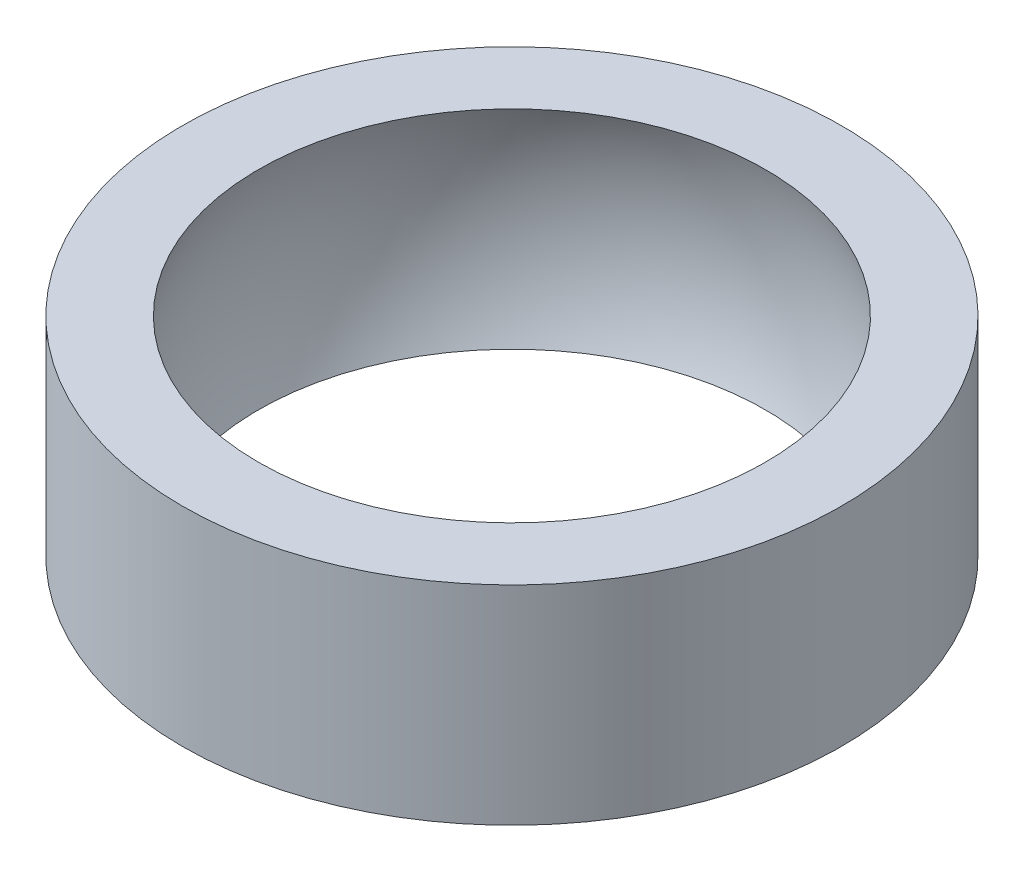
from build123d import *

# Parameters (mm, degrees)
SKETCH_1_R      = 9.5
EXTRUDE_1_DEPTH = 3


with BuildPart() as part:
    # 草图1 → 凸台-拉伸1 (new, symmetric)
    with BuildSketch(Plane(origin=(0, 0, 0), x_dir=(1, 0, 0), z_dir=(0, 1, 0))):
        Circle(SKETCH_1_R)
    extrude(amount=EXTRUDE_1_DEPTH, both=True)

    # 草图2 → 切除-旋转9 (revolve, cut)
    with BuildSketch(Plane(origin=(0, 0, 0), x_dir=(1, 0, 0), z_dir=(0, 1, 0))):
        with BuildLine():
            Line((7.9, 0), (-7.9, 0))
            ThreePointArc((-7.9, 0), (0, -7.9), (7.9, 0))
        make_face()
    revolve(axis=Axis((-7.9, 0, 0), (1, 0, 0)), mode=Mode.SUBTRACT)


solid = part.part
